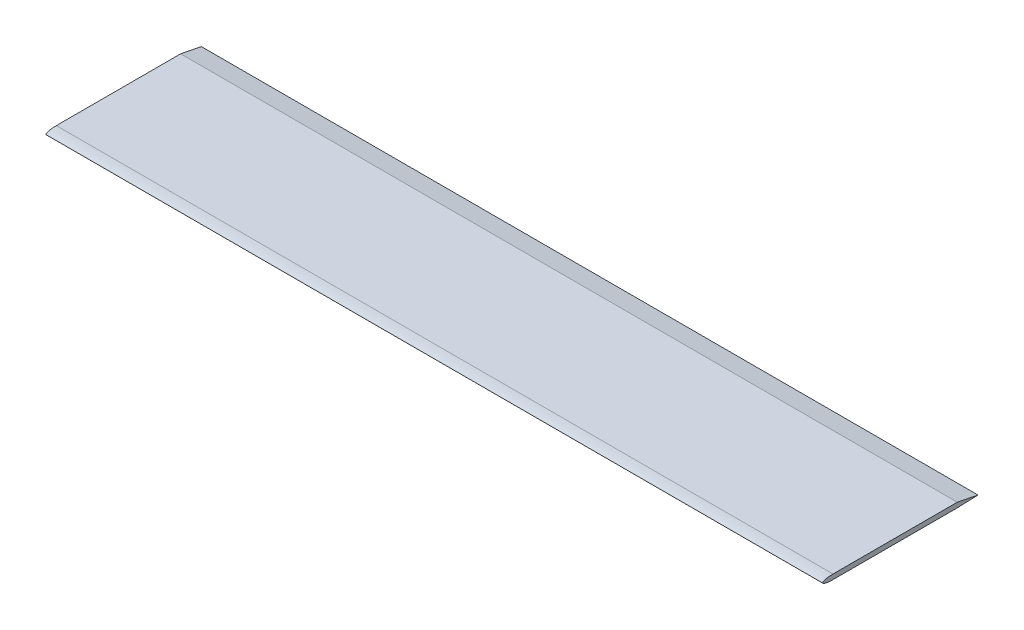
from build123d import *

# Parameters (mm, degrees)
BOSS_EXTRUDE1_DEPTH = 952.5


with BuildPart() as part:
    # Sketch1 → Boss-Extrude1 (new body)
    with BuildSketch(Plane(origin=(0, 0, 0), x_dir=(0, 0, -1), z_dir=(1, 0, 0))):
        with BuildLine():
            Line((-1.671536104, -2.999999969), (150.728463896, -2.999999969))
            Line((150.728463896, -2.999999969), (176.128463896, -1.999999937))
            Line((176.128463896, -1.999999937), (150.728463896, 2.999999969))
            Line((150.728463896, 2.999999969), (-1.671536104, 2.999999969))
            add(Edge.make_bspline(
                [(-1.671536104, 2.999999969), (-14.371536104, 2.999999969), (-14.371536104, 0)],
                knots=[4.71238898, 4.71238898, 4.71238898, 6.283185307, 6.283185307, 6.283185307], degree=2, weights=[1, 0.707106781, 1]))
            add(Edge.make_bspline(
                [(-14.371536104, 0), (-14.371536104, -2.999999969), (-1.671536104, -2.999999969)],
                knots=[0, 0, 0, 1.570796327, 1.570796327, 1.570796327], degree=2, weights=[1, 0.707106781, 1]))
        make_face()
    extrude(amount=BOSS_EXTRUDE1_DEPTH)


solid = part.part
